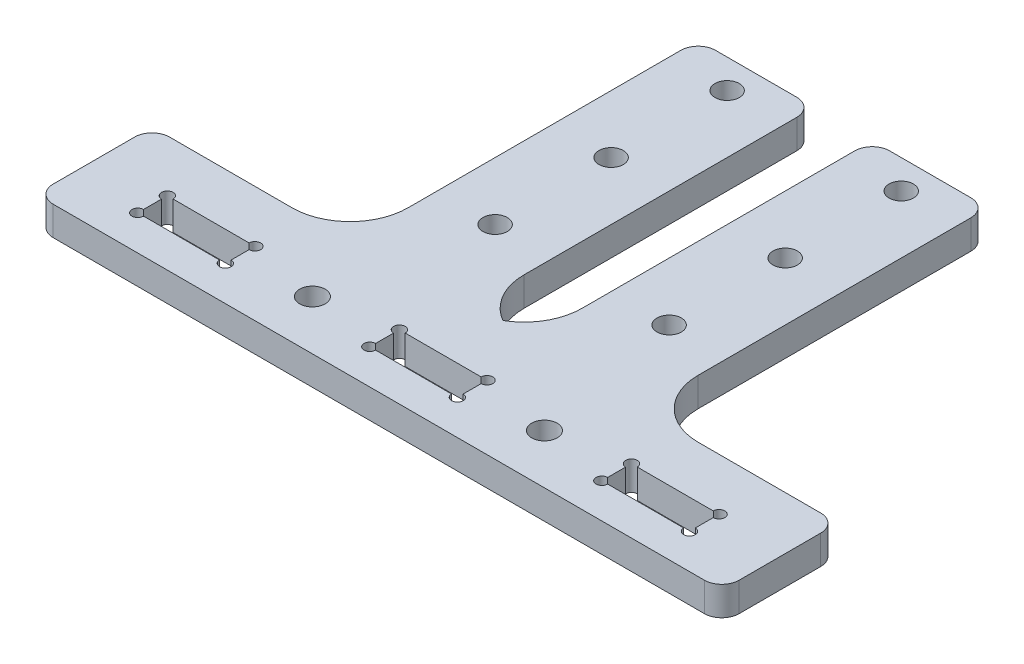
from build123d import *

# Parameters (mm, degrees)
EXTRUDE_4_DEPTH      = 5
EXTRUDE_5_DEPTH      = 5
EXTRUDE_6_DEPTH      = 5
SKETCH_5_R           = 1.7
CUT_EXTRUDE_1_DEPTH  = 5
EXTRUDE_7_DEPTH      = 5
SKETCH_7_R           = 1.7
CUT_EXTRUDE_2_DEPTH  = 5
SKETCH_12_W          = 15
SKETCH_12_H          = 3
EXTRUDE_10_DEPTH     = 5
CUT_EXTRUDE_5_DEPTH  = 5
SKETCH_14_W          = 15
SKETCH_14_H          = 5
EXTRUDE_11_DEPTH     = 5
SKETCH_16_R          = 2.2
CUT_EXTRUDE_7_DEPTH  = 5
CUT_EXTRUDE_8_DEPTH  = 5
SKETCH_19_R          = 2.2
CUT_EXTRUDE_9_DEPTH  = 5
EXTRUDE_12_DEPTH     = 5
FILLET_1_R           = 2
SKETCH_21_W          = 134.232837099
SKETCH_21_H          = 189.007158486
SKETCH_21_W_2        = 166.269417525
SKETCH_21_H_2        = 176.352735834
CUT_EXTRUDE_10_DEPTH = 314.073605795
SKETCH_22_W          = 20
SKETCH_22_H          = 60
SKETCH_22_R          = 2.1
EXTRUDE_13_DEPTH     = 5
FILLET_2_R           = 10
FILLET_3_R           = 3


with BuildPart() as part:
    # 草图2 → 凸台-拉伸4 (new body)
    with BuildSketch(Plane(origin=(0, 0, 0), x_dir=(1, 0, 0), z_dir=(0, 1, 0))):
        Polygon((-163.852515924, 124.182366776), (-43.852515924, 124.182366776), (16.242365952, 59.136369948), (32.045701527, 59.136369948), (51.147484076, 9.582366776), (51.147484076, -23.417633224), (71.147484076, -23.417633224), (71.147484076, 11.582366776), (41.16464964, 70.136369948), (23.597046938, 70.136369948), (-38.39605211, 137.236974827), (-169.308979739, 137.236974827), (-231.302078787, 70.136369948), (-248.869681489, 70.136369948), (-278.852515924, 11.582366776), (-278.852515924, -23.417633224), (-258.852515924, -23.417633224), (-258.852515924, 9.582366776), (-239.750733376, 59.136369948), (-223.947397801, 59.136369948), align=None)
    extrude(amount=EXTRUDE_4_DEPTH)

    # 草图3 → 凸台-拉伸5 (add)
    with BuildSketch(Plane(origin=(0, 5, 0), x_dir=(1, 0, 0), z_dir=(0, 1, 0))):
        Polygon((-258.852515924, -23.417633224), (-252.852515924, -23.417633224), (-252.852515924, 16.806798308), (-236.535564294, 59.136369948), (-239.750733376, 59.136369948), (-258.852515924, 9.582366776), align=None)
        Polygon((51.147484076, -23.417633224), (45.147484076, -23.417633224), (45.147484076, 16.806798308), (28.830532445, 59.136369948), (32.045701527, 59.136369948), (51.147484076, 9.582366776), align=None)
    extrude(amount=-EXTRUDE_5_DEPTH)

    # 草图4 → 凸台-拉伸6 (add)
    with BuildSketch(Plane(origin=(0, 5, 0), x_dir=(1, 0, 0), z_dir=(0, 1, 0))):
        Polygon((-252.852515924, 16.806798308), (-244.852515924, -15.417633224), (-244.852515924, -23.417633224), (-252.852515924, -23.417633224), align=None)
    extrude(amount=-EXTRUDE_6_DEPTH)

    # 草图5 → 切除-拉伸1 (cut)
    with BuildSketch(Plane.XZ):
        with Locations(Location((-273.852515924, 19.417633224, 0), (0, 0, 270))):
            Circle(SKETCH_5_R)
        with Locations(Location((-257.852515924, 19.417633224, 0), (0, 0, 270))):
            Circle(SKETCH_5_R)
    extrude(amount=-CUT_EXTRUDE_1_DEPTH, mode=Mode.SUBTRACT)

    # 草图6 → 凸台-拉伸7 (add)
    with BuildSketch(Plane(origin=(0, 5, 0), x_dir=(1, 0, 0), z_dir=(0, 1, 0))):
        Polygon((45.147484076, -23.417633224), (37.147484076, -23.417633224), (37.147484076, -15.417633224), (45.147484076, 16.806798308), align=None)
    extrude(amount=-EXTRUDE_7_DEPTH)

    # 草图7 → 切除-拉伸2 (cut)
    with BuildSketch(Plane.XZ):
        with Locations(Location((66.147484076, 19.417633224, 0), (0, 0, 270))):
            Circle(SKETCH_7_R)
        with Locations(Location((50.147484076, 19.417633224, 0), (0, 0, 270))):
            Circle(SKETCH_7_R)
    extrude(amount=-CUT_EXTRUDE_2_DEPTH, mode=Mode.SUBTRACT)

    # 草图13 → 切除-拉伸5 (cut)
    with BuildSketch(Plane(origin=(0, 5, 0), x_dir=(1, 0, 0), z_dir=(0, 1, 0))):
        with BuildLine():
            Line((-253.852515924, -23.417633224), (-251.852515924, -23.417633224))
            ThreePointArc((-251.852515924, -23.417633224), (-252.852515924, -22.417633224), (-253.852515924, -23.417633224))
        make_face()
        with BuildLine():
            Line((-268.852515924, -23.417633224), (-270.852515924, -23.417633224))
            ThreePointArc((-270.852515924, -23.417633224), (-269.852515924, -22.417633224), (-268.852515924, -23.417633224))
        make_face()
    cut_extrude_5 = extrude(amount=-CUT_EXTRUDE_5_DEPTH, mode=Mode.SUBTRACT)



with BuildPart() as body_2:
    # 草图12 → 凸台-拉伸10 (new body)
    with BuildSketch(Plane(origin=(0, 5, 0), x_dir=(1, 0, 0), z_dir=(0, 1, 0))):
        with Locations((-261.352515924, -24.917633224)):
            Rectangle(SKETCH_12_W, SKETCH_12_H)
    extrude(amount=-EXTRUDE_10_DEPTH)


with BuildPart() as part_1:
    add(part.part)

    add(body_2.part)  # 凸台-拉伸11 merges body 2
    # 草图14 → 凸台-拉伸11 (add)
    with BuildSketch(Plane.XY.offset(26.417633224)):
        with Locations((-261.352515924, 2.5)):
            Rectangle(SKETCH_14_W, SKETCH_14_H)
    extrude_11 = extrude(amount=-EXTRUDE_11_DEPTH)

    # 镜向4: 切除-拉伸5, 凸台-拉伸11 across plane
    add(cut_extrude_5.mirror(Plane.ZY.offset(103.852515924)), mode=Mode.SUBTRACT)
    add(extrude_11.mirror(Plane.ZY.offset(103.852515924)))

    # 草图16 → 切除-拉伸7 (cut)
    with BuildSketch(Plane(origin=(0, 5, 0), x_dir=(1, 0, 0), z_dir=(0, 1, 0))):
        with Locations(Location((-222.724177384, 69.940679724, 0), (0, 0, 270))):
            Circle(SKETCH_16_R)
        with Locations(Location((-182.008197488, 114.011179848, 0), (0, 0, 270))):
            Circle(SKETCH_16_R)
        with Locations(Location((-209.152184085, 84.630846432, 0), (0, 0, 270))):
            Circle(SKETCH_16_R)
        with Locations(Location((1.447152236, 84.630846432, 0), (0, 0, 90))):
            Circle(SKETCH_16_R)
        with Locations(Location((-25.696834361, 114.011179848, 0), (0, 0, 90))):
            Circle(SKETCH_16_R)
        with Locations(Location((15.019145535, 69.940679724, 0), (0, 0, 90))):
            Circle(SKETCH_16_R)
        with Locations(Location((-262.852515924, 20.136369948, 0), (0, 0, 270))):
            Circle(SKETCH_16_R)
        with Locations(Location((55.147484076, 20.136369948, 0), (0, 0, 90))):
            Circle(SKETCH_16_R)
    extrude(amount=-CUT_EXTRUDE_7_DEPTH, mode=Mode.SUBTRACT)

    # 草图18 → 切除-拉伸8 (cut)
    with BuildSketch(Plane(origin=(0, 5, 0), x_dir=(1, 0, 0), z_dir=(0, 1, 0))):
        with BuildLine():
            Line((-151.402515924, 132.286974827), (-151.402515924, 129.186974827))
            ThreePointArc((-151.402515924, 129.186974827), (-152.109622706, 127.479868046), (-150.402515924, 128.186974827))
            Line((-150.402515924, 128.186974827), (-137.302515924, 128.186974827))
            ThreePointArc((-137.302515924, 128.186974827), (-135.595409143, 127.479868046), (-136.302515924, 129.186974827))
            Line((-136.302515924, 129.186974827), (-136.302515924, 132.286974827))
            ThreePointArc((-136.302515924, 132.286974827), (-135.595409143, 133.994081608), (-137.302515924, 133.286974827))
            Line((-137.302515924, 133.286974827), (-150.402515924, 133.286974827))
            ThreePointArc((-150.402515924, 133.286974827), (-152.109622706, 133.994081608), (-151.402515924, 132.286974827))
        make_face()
        with BuildLine():
            Line((-97.302515924, 133.286974827), (-110.402515924, 133.286974827))
            ThreePointArc((-110.402515924, 133.286974827), (-112.109622706, 133.994081608), (-111.402515924, 132.286974827))
            Line((-111.402515924, 132.286974827), (-111.402515924, 129.186974827))
            ThreePointArc((-111.402515924, 129.186974827), (-112.109622706, 127.479868046), (-110.402515924, 128.186974827))
            Line((-110.402515924, 128.186974827), (-97.302515924, 128.186974827))
            ThreePointArc((-97.302515924, 128.186974827), (-95.595409143, 127.479868046), (-96.302515924, 129.186974827))
            Line((-96.302515924, 129.186974827), (-96.302515924, 132.286974827))
            ThreePointArc((-96.302515924, 132.286974827), (-95.595409143, 133.994081608), (-97.302515924, 133.286974827))
        make_face()
        with BuildLine():
            Line((-57.302515924, 133.286974827), (-70.402515924, 133.286974827))
            ThreePointArc((-70.402515924, 133.286974827), (-72.109622706, 133.994081608), (-71.402515924, 132.286974827))
            Line((-71.402515924, 132.286974827), (-71.402515924, 129.186974827))
            ThreePointArc((-71.402515924, 129.186974827), (-72.109622706, 127.479868046), (-70.402515924, 128.186974827))
            Line((-70.402515924, 128.186974827), (-57.302515924, 128.186974827))
            ThreePointArc((-57.302515924, 128.186974827), (-55.595409143, 127.479868046), (-56.302515924, 129.186974827))
            Line((-56.302515924, 129.186974827), (-56.302515924, 132.286974827))
            ThreePointArc((-56.302515924, 132.286974827), (-55.595409143, 133.994081608), (-57.302515924, 133.286974827))
        make_face()
    extrude(amount=-CUT_EXTRUDE_8_DEPTH, mode=Mode.SUBTRACT)

    # 草图19 → 切除-拉伸9 (cut)
    with BuildSketch(Plane.XZ):
        with Locations(Location((-123.852515924, -130.736974827, 0), (0, 0, 270))):
            Circle(SKETCH_19_R)
        with Locations(Location((-83.852515924, -130.736974827, 0), (0, 0, 90))):
            Circle(SKETCH_19_R)
    extrude(amount=-CUT_EXTRUDE_9_DEPTH, mode=Mode.SUBTRACT)

    # 草图20 → 凸台-拉伸12 (add)
    with BuildSketch(Plane.XZ):
        Polygon((29.601480556, -57.136369948), (15.367221806, -57.136369948), (-44.727660071, -122.182366776), (-162.977371778, -122.182366776), (-223.072253655, -57.136369948), (-237.306512405, -57.136369948), (-236.535564294, -59.136369948), (-223.947397801, -59.136369948), (-163.852515924, -124.182366776), (-43.852515924, -124.182366776), (16.242365952, -59.136369948), (28.830532445, -59.136369948), align=None)
        Polygon((-248.869681489, -70.136369948), (-246.309409534, -75.136369948), (-233.489939153, -75.136369948), (-171.496840105, -142.236974827), (-36.208191744, -142.236974827), (25.784907304, -75.136369948), (38.604377685, -75.136369948), (41.16464964, -70.136369948), (23.597046938, -70.136369948), (-38.39605211, -137.236974827), (-169.308979739, -137.236974827), (-231.302078787, -70.136369948), align=None)
    extrude(amount=-EXTRUDE_12_DEPTH)

    # 圆角1
    fillet_1_edges = [part_1.edges().sort_by_distance(p)[0] for p in [
        (-278.852515924, 2.5, 23.417633224),
        (71.147484076, 2.5, 23.417633224),
        (-244.852515924, 2.5, 23.417633224),
        (-244.852515924, 2.5, 15.417633224),
        (37.147484076, 2.5, 23.417633224),
        (37.147484076, 2.5, 15.417633224),
    ]]
    fillet(fillet_1_edges, radius=FILLET_1_R)

    # 草图21 → 切除-拉伸10 (cut, through all)
    with BuildSketch(Plane.XZ):
        with Locations((-230.093790328, -47.733395584)):
            Rectangle(SKETCH_21_W, SKETCH_21_H)
        with Locations((38.407048692, -54.06060691)):
            Rectangle(SKETCH_21_W_2, SKETCH_21_H_2)
    extrude(amount=-CUT_EXTRUDE_10_DEPTH, mode=Mode.SUBTRACT)

    # 草图22 → 凸台-拉伸13 (add, through all)
    # profile 1 of 2: a face of its own
    with BuildSketch(Plane.XZ):
        with Locations((-118.852515924, -172.236974827)):
            Rectangle(SKETCH_22_W, SKETCH_22_H)
        with Locations(Location((-118.852515924, -197.236974827, 0), (0, 0, 270))):
            Circle(SKETCH_22_R, mode=Mode.SUBTRACT)
        with Locations(Location((-118.852515924, -177.236974827, 0), (0, 0, 270))):
            Circle(SKETCH_22_R, mode=Mode.SUBTRACT)
        with Locations(Location((-118.852515924, -157.236974827, 0), (0, 0, 270))):
            Circle(SKETCH_22_R, mode=Mode.SUBTRACT)
    # profile 2 of 2: a face of its own
    with BuildSketch(Plane.XZ):
        with Locations((-88.852515924, -172.236974827)):
            Rectangle(SKETCH_22_W, SKETCH_22_H)
        with Locations(Location((-88.852515924, -197.236974827, 0), (0, 0, 90))):
            Circle(SKETCH_22_R, mode=Mode.SUBTRACT)
        with Locations(Location((-88.852515924, -177.236974827, 0), (0, 0, 90))):
            Circle(SKETCH_22_R, mode=Mode.SUBTRACT)
        with Locations(Location((-88.852515924, -157.236974827, 0), (0, 0, 90))):
            Circle(SKETCH_22_R, mode=Mode.SUBTRACT)
    extrude(amount=-EXTRUDE_13_DEPTH)

    # 圆角2
    # the kernel refuses this fillet: 10 mm, written as the material it adds along each edge
    with BuildSketch(Plane(origin=(-128.852515924, 0, -142.236974827), x_dir=(-1, 0, 0), z_dir=(0, 1, 0)), Plane(origin=(-98.852515924, 0, -142.236974827), x_dir=(-1, 0, 0), z_dir=(0, 1, 0))) as fillet_2_piece_1:
        with BuildLine():
            CenterArc((FILLET_2_R, -FILLET_2_R), FILLET_2_R, 90, 90)
            Line((0, -FILLET_2_R), (0, 0))
            Line((0, 0), (FILLET_2_R, 0))
        make_face()
    extrude(amount=5)
    with BuildSketch(Plane(origin=(-108.852515924, 0, -142.236974827), x_dir=(1, 0, 0), z_dir=(0, 1, 0)), Plane(origin=(-78.852515924, 0, -142.236974827), x_dir=(1, 0, 0), z_dir=(0, 1, 0))) as fillet_2_piece_2:
        with BuildLine():
            CenterArc((FILLET_2_R, FILLET_2_R), FILLET_2_R, 180, 90)
            Line((0, FILLET_2_R), (0, 0))
            Line((0, 0), (FILLET_2_R, 0))
        make_face()
    extrude(amount=5)

    # 圆角3
    fillet_3_edges = [part_1.edges().sort_by_distance(p)[0] for p in [
        (-162.977371778, 2.5, -122.182366776),
        (-44.727660071, 2.5, -122.182366776),
        (-162.977371778, 2.5, -142.236974827),
        (-44.727660071, 2.5, -142.236974827),
        (-128.852515924, 2.5, -202.236974827),
        (-108.852515924, 2.5, -202.236974827),
        (-78.852515924, 2.5, -202.236974827),
        (-98.852515924, 2.5, -202.236974827),
    ]]
    fillet(fillet_3_edges, radius=FILLET_3_R)


solid = part_1.part
